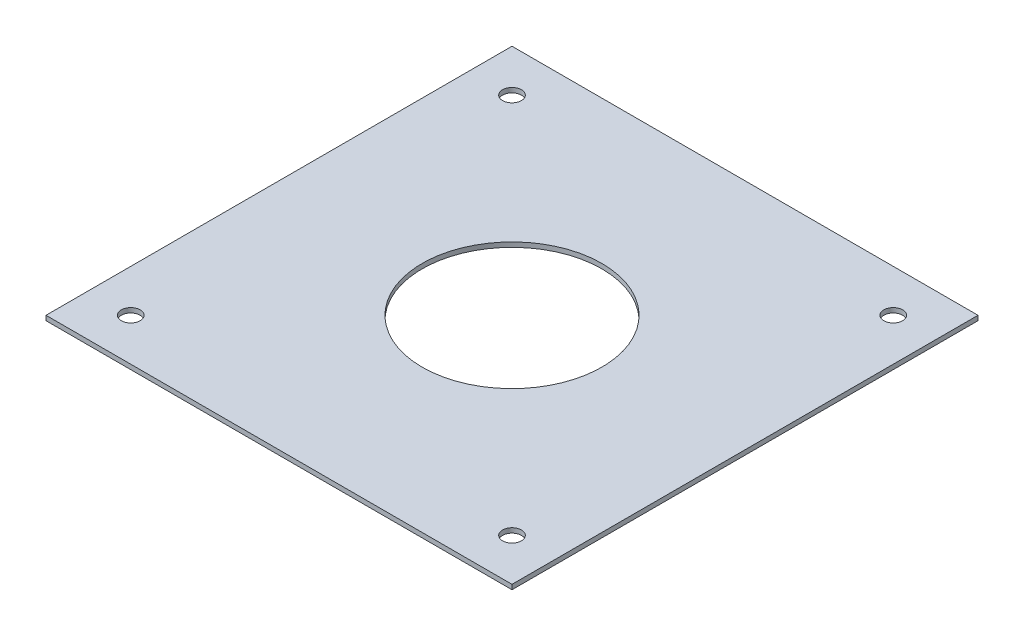
from build123d import *

# Parameters (mm, degrees)
SKETCH1_W           = 98.782817332
SKETCH1_H           = 98.782817332
BOSS_EXTRUDE1_DEPTH = 1.000000032
SKETCH3_R           = 2.000000064
CUT_EXTRUDE2_DEPTH  = 70.85715783
SKETCH8_R           = 19.05
CUT_EXTRUDE9_DEPTH  = 70.85715783


with BuildPart() as part:
    # Sketch1 → Boss-Extrude1 (new body)
    with BuildSketch(Plane(origin=(0, 0, 0), x_dir=(1, 0, 0), z_dir=(0, 1, 0))):
        Rectangle(SKETCH1_W, SKETCH1_H)
    extrude(amount=BOSS_EXTRUDE1_DEPTH)

    # Sketch3 → Cut-Extrude2 (cut, through all)
    with BuildSketch(Plane(origin=(0, 0, 0), x_dir=(1, 0, 0), z_dir=(0, 1, 0))):
        with Locations((40.411152545, 40.411152545)):
            Circle(SKETCH3_R)
        with Locations((40.411152545, -40.411152545)):
            Circle(SKETCH3_R)
        with Locations((-40.411152545, -40.411152545)):
            Circle(SKETCH3_R)
        with Locations((-40.411152545, 40.411152545)):
            Circle(SKETCH3_R)
    extrude(amount=CUT_EXTRUDE2_DEPTH, mode=Mode.SUBTRACT)

    # Sketch8 → Cut-Extrude9 (cut, through all)
    with BuildSketch(Plane(origin=(0, 0, 0), x_dir=(1, 0, 0), z_dir=(0, 1, 0))):
        Circle(SKETCH8_R)
    extrude(amount=CUT_EXTRUDE9_DEPTH, mode=Mode.SUBTRACT)


solid = part.part
